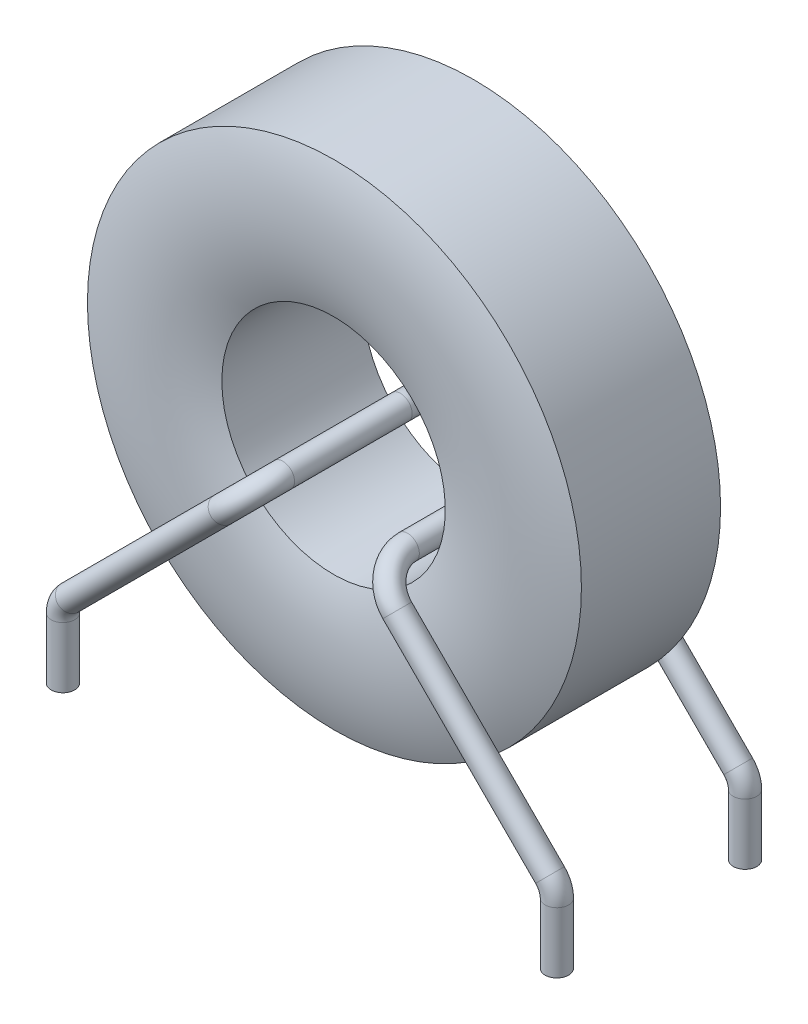
from build123d import *

# Parameters (mm, degrees)
SKETCH_7_R          = 0.5
SKETCH_6_R          = 0.5
SWEEP_5_OUTLINE_R   = 0.5
SWEEP_5_ANGLE       = 45
SWEEP_5_2_OUTLINE_R = 0.5
SWEEP_5_2_ANGLE     = 90
SWEEP_START         = -13.5
SWEEP_5_3_OUTLINE_R = 0.5
SWEEP_5_3_DEPTH     = 2.585786538
SWEEP_START_2       = 5.2499999
SWEEP_5_4_OUTLINE_R = 0.5
SWEEP_5_4_DEPTH     = 9.185029043
SWEEP_5_5_OUTLINE_R = 0.5
SWEEP_5_5_DEPTH     = 2.5000001
SKETCH_9_R          = 0.5


with BuildPart() as part:
    # Эскиз1 → Повернуть1 (revolve)
    with BuildSketch(Plane(origin=(0, 0, 0), x_dir=(1, 0, 0), z_dir=(0, 1, 0)), mode=Mode.PRIVATE) as revolve_1_sk:
        with BuildLine():
            Line((4.75, 2.99430396), (4.75, -2.99430396))
            ThreePointArc((4.75, -2.99430396), (7.628312068, -3.5), (10.5, -2.957950866))
            Line((10.5, -2.957950866), (10.5, 2.957950866))
            ThreePointArc((10.5, 2.957950866), (7.628312068, 3.5), (4.75, 2.99430396))
        make_face()
    revolve(revolve_1_sk.sketch.rotate(Axis((0, 0, -4.307692308), (0, 0, 1)), 180), axis=Axis((0, 0, -4.307692308), (0, 0, 1)))


with BuildPart() as body_2:
    # По траектории2: sweep along a curve in space
    with BuildLine() as sweep_2_path:
        Line((-10.5, -13.5, 3.499999979), (-10.5, -10.914213562, 3.499999979))
        ThreePointArc((-10.5, -10.914213562, 3.499999979), (-10.423879533, -10.53153013, 3.499999979), (-10.207106781, -10.207106781, 3.499999979))
        Line((-10.207106781, -10.207106781, 3.499999979), (-3.712310601, -3.712310601, 3.499999979))
        ThreePointArc((-3.712310601, -3.712310601, 3.499999979), (-3.212310601, -3.212310601, 3.207106761), (-3.00520382, -3.00520382, 2.499999979))
        Line((-3.00520382, -3.00520382, 0), (-3.00520382, -3.00520382, 2.499999979))
    # Эскиз7 → По траектории2 (sweep)
    with BuildSketch(Plane.XY):
        with Locations((-2.651650429, -2.651650429)):
            Circle(SKETCH_7_R)
    sweep(path=sweep_2_path.line)

    # По траектории4: sweep along a curve in space
    with BuildLine() as sweep_4_path:
        Line((-10.5, -13.5, -3.5), (-10.5, -10.914213562, -3.5))
        ThreePointArc((-10.5, -10.914213562, -3.5), (-10.423879533, -10.53153013, -3.5), (-10.207106781, -10.207106781, -3.5))
        Line((-10.207106781, -10.207106781, -3.5), (-3.712310601, -3.712310601, -3.5))
        ThreePointArc((-3.712310601, -3.712310601, -3.5), (-3.212310601, -3.212310601, -3.207106781), (-3.00520382, -3.00520382, -2.5))
        Line((-3.00520382, -3.00520382, -2.5), (-3.00520382, -3.00520382, 0))
    # Эскиз6 → По траектории4 (sweep)
    with BuildSketch(Plane.XY):
        with Locations((-2.651650429, -2.651650429)):
            Circle(SKETCH_6_R)
    sweep(path=sweep_4_path.line)


with BuildPart() as body_3:
    # По траектории5: read off the stored shape, not the designer's step
    # По траектории5 outline → По траектории5 (revolve)
    with BuildSketch(Plane(origin=(9.5, -10.914213562, 0), x_dir=(1, 0, 0), z_dir=(0, -1, 0))):
        with Locations((1, 4)):
            Circle(SWEEP_5_OUTLINE_R)
    revolve(axis=Axis((9.5, -10.914213562, 0), (0, 0, 1)), revolution_arc=SWEEP_5_ANGLE)

    # Sweep 5 2 outline → Sweep 5 2 (revolve)
    with BuildSketch(Plane(origin=(3.712310601, -3.712310601, 2.5), x_dir=(-0.707106781186557, 0.707106781186538, 0), z_dir=(0, 0, -1))):
        with Locations((1.5, 0)):
            Circle(SWEEP_5_2_OUTLINE_R)
    revolve(axis=Axis((3.712310601, -3.712310601, 2.5), (0.707106781186538, 0.707106781186557, 0)), revolution_arc=SWEEP_5_2_ANGLE)

    # Sweep 5 3 outline → Sweep 5 3 (add)
    with BuildSketch(Plane(origin=(0, 0, 0), x_dir=(1, 0, 0), z_dir=(0, 1, 0)).offset(SWEEP_START)):
        with Locations((10.5, -4)):
            Circle(SWEEP_5_3_OUTLINE_R)
    extrude(amount=SWEEP_5_3_DEPTH)

    # Sweep 5 4 outline → Sweep 5 4 (add)
    with BuildSketch(Plane(origin=(0, 0, 0), x_dir=(0.707106781186539, 0.707106781186556, 0), z_dir=(0.707106781186556, -0.707106781186539, 0)).offset(SWEEP_START_2)):
        with Locations((0, 4)):
            Circle(SWEEP_5_4_OUTLINE_R)
    extrude(amount=SWEEP_5_4_DEPTH)

    # Sweep 5 5 outline → Sweep 5 5 (add)
    with BuildSketch(Plane.XY):
        with Locations((2.651650429, -2.651650429)):
            Circle(SWEEP_5_5_OUTLINE_R)
    extrude(amount=SWEEP_5_5_DEPTH)

    # По траектории6: sweep along a curve in space
    with BuildLine() as sweep_6_path:
        Line((3.00520382, -3.00520382, -2.5), (3.00520382, -3.00520382, 0))
        ThreePointArc((3.712310601, -3.712310601, -3.5), (3.212310601, -3.212310601, -3.207106781), (3.00520382, -3.00520382, -2.5))
        Line((10.207106781, -10.207106781, -3.5), (3.712310601, -3.712310601, -3.5))
        ThreePointArc((10.5, -10.914213562, -3.5), (10.423879533, -10.53153013, -3.5), (10.207106781, -10.207106781, -3.5))
        Line((10.5, -13.5, -3.5), (10.5, -10.914213562, -3.5))
    # Эскиз9 → По траектории6 (sweep)
    with BuildSketch(Plane.XY):
        with Locations((2.651650429, -2.651650429)):
            Circle(SKETCH_9_R)
    sweep(path=sweep_6_path.line)


solid = Compound([part.part, body_2.part, body_3.part])
